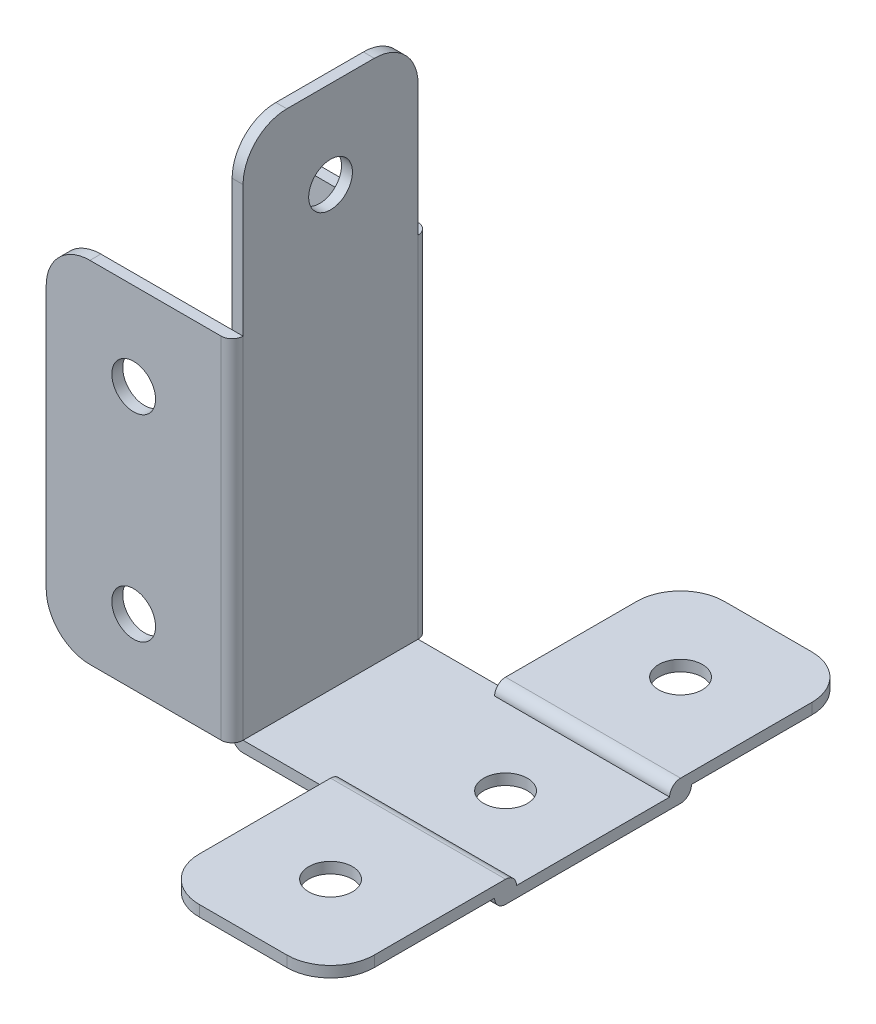
from build123d import *

# Parameters (mm, degrees)
SKETCH1_W             = 25.4
SKETCH1_H             = 50.8
SKETCH1_R             = 3.175
BOSS_EXTRUDE1_DEPTH   = 1.5875
BOSS_EXTRUDE2_START   = -25.4
SKETCH1_2_W           = 25.4
SKETCH1_2_H           = 50.8
SKETCH1_2_R           = 3.175
BOSS_EXTRUDE2_DEPTH   = 1.5875
SKETCH3_R             = 3.175
BOSS_EXTRUDE3_DEPTH   = 1.5875
SKETCH4_W             = 38.1
SKETCH4_H             = 25.4
SKETCH4_R             = 3.175
BOSS_EXTRUDE4_DEPTH   = 1.5875
SKETCH6_W             = 1.5875
SKETCH6_H             = 50.8
REVOLVE1_ANGLE        = 90
SKETCH7_W             = 1.5875
SKETCH7_H             = 50.8
REVOLVE2_ANGLE        = 90
SKETCH8_W             = 25.4
SKETCH8_H             = 1.5875
REVOLVE3_ANGLE        = 90
SKETCH9_W             = 25.4
SKETCH9_H             = 25.4
SKETCH9_R             = 3.175
BOSS_EXTRUDE5_DEPTH   = 1.5875
BOSS_EXTRUDE5_2_DEPTH = 1.5875
SKETCH12_W            = 25.4
SKETCH12_H            = 1.5875
SKETCH13_W            = 25.4
SKETCH13_H            = 1.5875
FILLET6_R             = 6.35


with BuildPart() as part:
    # Sketch1 → Boss-Extrude1 (new body)
    with BuildSketch(Plane.XY):
        with Locations((-12.7, 25.4)):
            Rectangle(SKETCH1_W, SKETCH1_H)
        with Locations((-12.7, 38.1)):
            Circle(SKETCH1_R, mode=Mode.SUBTRACT)
        with Locations((-12.7, 9.525)):
            Circle(SKETCH1_R, mode=Mode.SUBTRACT)
    extrude(amount=BOSS_EXTRUDE1_DEPTH)



with BuildPart() as body_2:
    # Sketch1<2> → Boss-Extrude2 (new body)
    with BuildSketch(Plane.XY.offset(BOSS_EXTRUDE2_START)):
        with Locations((-12.7, 25.4)):
            Rectangle(SKETCH1_2_W, SKETCH1_2_H)
        with Locations((-12.7, 38.1)):
            Circle(SKETCH1_2_R, mode=Mode.SUBTRACT)
        with Locations((-12.7, 9.525)):
            Circle(SKETCH1_2_R, mode=Mode.SUBTRACT)
    extrude(amount=-BOSS_EXTRUDE2_DEPTH)



with BuildPart() as body_3:
    # Sketch3 → Boss-Extrude3 (new body)
    with BuildSketch(Plane(origin=(0, 0, 0), x_dir=(0, 0, -1), z_dir=(1, 0, 0))):
        Polygon((25.4, 50.8), (25.4, 0), (0, 0), (0, 50.8), (0, 76.2), (25.4, 76.2), align=None)
        with Locations((12.7, 63.5)):
            Circle(SKETCH3_R, mode=Mode.SUBTRACT)
    extrude(amount=BOSS_EXTRUDE3_DEPTH)


with BuildPart() as body_4:
    # Sketch4 → Boss-Extrude4 (new body)
    with BuildSketch(Plane(origin=(0, 0, 0), x_dir=(1, 0, 0), z_dir=(0, 1, 0))):
        with Locations((20.6375, 12.7)):
            Rectangle(SKETCH4_W, SKETCH4_H)
        with Locations((26.9875, 12.7)):
            Circle(SKETCH4_R, mode=Mode.SUBTRACT)
    extrude(amount=-BOSS_EXTRUDE4_DEPTH)


with BuildPart() as part_1:
    add(part.part)

    add(body_3.part)  # Revolve1 merges body 3
    # Sketch6 → Revolve1 (revolve)
    with BuildSketch(Plane(origin=(0, 0, 0), x_dir=(0, 0, -1), z_dir=(1, 0, 0))):
        with Locations((-0.79375, 25.4)):
            Rectangle(SKETCH6_W, SKETCH6_H)
    revolve(axis=Axis((0, 0, 0), (0, 1, 0)), revolution_arc=REVOLVE1_ANGLE)


with BuildPart() as body_2_1:
    add(body_2.part)

    add(part_1.part)  # Revolve2 merges part
    # Sketch7 → Revolve2 (revolve)
    with BuildSketch(Plane(origin=(0, 0, 0), x_dir=(0, 0, -1), z_dir=(1, 0, 0))):
        with Locations((26.19375, 25.4)):
            Rectangle(SKETCH7_W, SKETCH7_H)
    revolve(axis=Axis((0, 50.8, -25.4), (0, -1, 0)), revolution_arc=REVOLVE2_ANGLE)


    add(body_4.part)  # Revolve3 merges body 4
    # Sketch8 → Revolve3 (revolve)
    with BuildSketch(Plane.ZY.offset(-1.5875)):
        with Locations((-12.7, -0.79375)):
            Rectangle(SKETCH8_W, SKETCH8_H)
    revolve(axis=Axis((1.5875, 0, 0), (0, 0, -1)), revolution_arc=REVOLVE3_ANGLE)



with BuildPart() as body_2_2:
    # Sketch9 → Boss-Extrude5 (new body)
    with BuildSketch(Plane(origin=(0, 0, 0), x_dir=(1, 0, 0), z_dir=(0, 1, 0))):
        with Locations((26.9875, 38.1)):
            Rectangle(SKETCH9_W, SKETCH9_H)
        with Locations((26.9875, 38.1)):
            Circle(SKETCH9_R, mode=Mode.SUBTRACT)
    extrude(amount=BOSS_EXTRUDE5_DEPTH)


with BuildPart() as body_3_2:
    # Sketch9 → Boss-Extrude5 2 (new body)
    with BuildSketch(Plane(origin=(0, 0, 0), x_dir=(1, 0, 0), z_dir=(0, 1, 0))):
        with Locations((26.9875, -12.7)):
            Rectangle(SKETCH9_W, SKETCH9_H)
        with Locations((26.9875, -12.7)):
            Circle(SKETCH9_R, mode=Mode.SUBTRACT)
    extrude(amount=BOSS_EXTRUDE5_2_DEPTH)


with BuildPart() as body_2_3:
    add(body_2_1.part)

    add(body_2_2.part)  # Revolve6 merges body 2 2
    # Sketch12 → Revolve6 (revolve)
    with BuildSketch(Plane.XY.offset(-25.4)):
        with Locations((26.9875, 0.79375)):
            Rectangle(SKETCH12_W, SKETCH12_H)
    revolve(axis=Axis((14.2875, 0, -25.4), (1, 0, 0)))


    add(body_3_2.part)  # Revolve7 merges body 3 2
    # Sketch13 → Revolve7 (revolve)
    with BuildSketch(Plane(origin=(0, 0, 0), x_dir=(-1, 0, 0), z_dir=(0, 0, -1))):
        with Locations((-26.9875, 0.79375)):
            Rectangle(SKETCH13_W, SKETCH13_H)
    revolve(axis=Axis((39.6875, 0, 0), (-1, 0, 0)))

    # Fillet6
    fillet6_edges = [body_2_3.edges().sort_by_distance(p)[0] for p in [
        (14.2875, 0.79375, -50.8),
        (39.6875, 0.79375, -50.8),
        (14.2875, 0.79375, 25.4),
        (39.6875, 0.79375, 25.4),
        (-25.4, 0, 0.79375),
        (-25.4, 0, -26.19375),
        (-25.4, 50.8, 0.79375),
        (-25.4, 50.8, -26.19375),
        (0.79375, 76.2, 0),
        (0.79375, 76.2, -25.4),
    ]]
    fillet(fillet6_edges, radius=FILLET6_R)


solid = body_2_3.part
